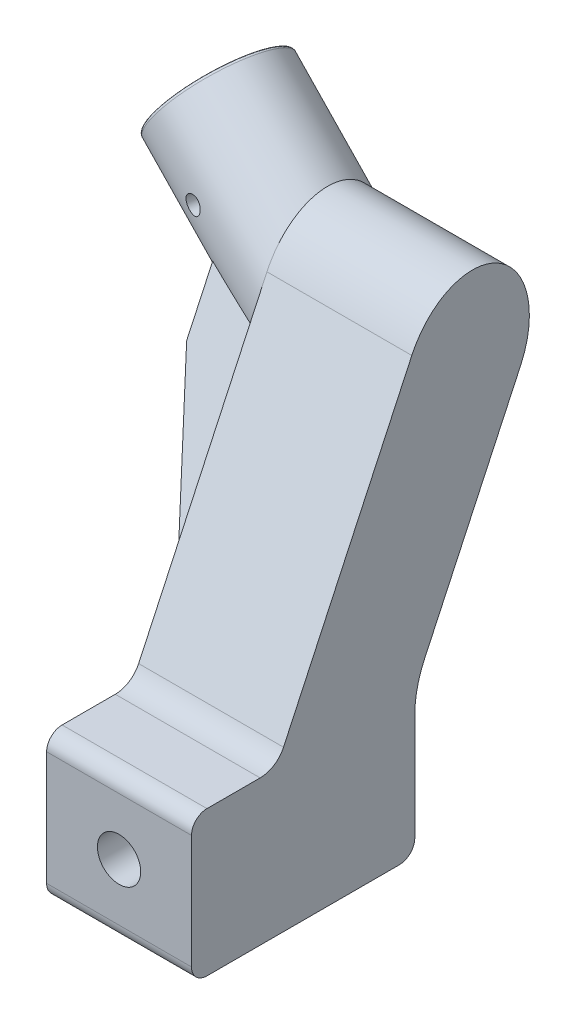
from build123d import *

# Parameters (mm, degrees)
BOSS_EXTRUDE1_REACH      = 70.941
SKETCH2_R                = 12.05
SKETCH2_R_2              = 10.05
CUT_EXTRUDE4_DEPTH       = 45.361925701
CUT_EXTRUDE4_DEPTH_BACK  = 45.361925701
SKETCH15_R               = 1.7
BOSS_EXTRUDE2_DEPTH      = 28.098
CUT_EXTRUDE2_DEPTH       = 95.819673868
CUT_EXTRUDE2_DEPTH_BACK  = 7.874
SKETCH10_R               = 11.074
CUT_EXTRUDE3_DEPTH       = 92.491925461
CUT_EXTRUDE3_DEPTH_BACK  = 92.491925461
SKETCH11_R               = 4.2
FILLET8_R                = 20
FILLET9_R                = 3
FILLET10_R               = 0.5
FILLET11_R               = 5
BOSS_EXTRUDE6_DEPTH      = 9
BOSS_EXTRUDE7_REACH      = 88.141
BOSS_EXTRUDE7_END_RADIUS = 12.05


with BuildPart() as part:
    # Boss-Extrude1: up to this plane
    boss_extrude1_end = Plane(origin=(0, 0, 0), z_dir=(1, 0, 0))
    # Sketch2 → Boss-Extrude1 (new, up to the surface)
    with BuildSketch(Plane(origin=(-24.54792956, 16.693219235, -4.328462302), x_dir=(-0.11959871019830814, -0.41029591122071263, -0.9040759999880907), z_dir=(-0.8182643186533396, 0.556440641176915, -0.1442820767296128)), mode=Mode.PRIVATE) as boss_extrude1_sk1:
        Circle(SKETCH2_R)
        Circle(SKETCH2_R_2, mode=Mode.SUBTRACT)
    boss_extrude1_tool1 = split(extrude(boss_extrude1_sk1.sketch, amount=-BOSS_EXTRUDE1_REACH, mode=Mode.PRIVATE), bisect_by=boss_extrude1_end, keep=Keep.BOTH, mode=Mode.PRIVATE)
    add(boss_extrude1_tool1.solids().sort_by_distance((-23.147527, 21.497446, 6.257521))[0])

    # Sketch15 → Cut-Extrude4 (cut, two sides: drawn at the far end of the back side and taken through both)
    with BuildSketch(Plane(origin=(0, 0, 0), x_dir=(0, -1, 0), z_dir=(0.17364817766693072, 0, -0.984807753012208)).offset(-CUT_EXTRUDE4_DEPTH_BACK)):
        with Locations((-9.05807293, 13.52568053)):
            Circle(SKETCH15_R)
    extrude(amount=CUT_EXTRUDE4_DEPTH + CUT_EXTRUDE4_DEPTH_BACK, mode=Mode.SUBTRACT)

    # Sketch4 → Boss-Extrude2 (add)
    with BuildSketch(Plane(origin=(0, 0, 0), x_dir=(0, 0, -1), z_dir=(1, 0, 0))):
        with BuildLine():
            Line((-10.564289597, 6.088663203), (-36.79343786, -50.159926765))
            Line((-36.79343786, -50.159926765), (-53.29343786, -50.159926765))
            Line((-53.29343786, -50.159926765), (-53.29343786, -78.259926765))
            Line((-53.29343786, -78.259926765), (-9.986478106, -78.259926765))
            Line((-9.986478106, -78.259926765), (-9.986478106, -50.159926765))
            Line((-9.986478106, -50.159926765), (10.564289597, -6.088663203))
            add(Edge.make_bspline(
                [(10.564289597, -6.088663203), (12.310435201, -2.344041872), (13.351511276, 2.865076656), (12.175818184, 8.040449248), (9.161589312, 11.517101667), (5.72338805, 13.498687776), (5.249277659, 13.733812564), (4.752089372, 13.940747349), (4.233531889, 14.115559854), (0.667047101, 15.04033025), (-3.094527455, 14.706908379), (-6.583627983, 12.515676914), (-9.081213608, 9.269129926), (-10.564289597, 6.088663203)],
                knots=[4.490407715, 4.490407715, 4.490407715, 4.490407715, 4.490407715, 4.490407715, 6.061204042, 6.061204042, 6.061204042, 6.061204042, 6.297856005, 6.297856005, 6.297856005, 6.297856005, 7.632000369, 7.632000369, 7.632000369, 7.632000369, 7.632000369, 7.632000369], degree=5, weights=[1, 1, 0.965685425, 0.965685425, 1, 1, 1.000003514, 1.000001188, 1, 1, 0.979939626, 0.982930028, 1, 1]))
        make_face()
    extrude(amount=BOSS_EXTRUDE2_DEPTH)

    # Sketch10 → Cut-Extrude2 (cut, two sides: drawn at the far end of the back side and taken through both)
    with BuildSketch(Plane(origin=(0, 0, 9.986478106), x_dir=(-1, 0, 0), z_dir=(0, 0, -1)).offset(-CUT_EXTRUDE2_DEPTH_BACK)):
        with Locations((-14.049, -64.209926765)):
            Circle(SKETCH10_R)
    extrude(amount=CUT_EXTRUDE2_DEPTH + CUT_EXTRUDE2_DEPTH_BACK, mode=Mode.SUBTRACT)

    # Sketch11 → Cut-Extrude3 (cut, two sides: drawn at the far end of the back side and taken through both)
    with BuildSketch(Plane(origin=(0, 0, 17.860478106), x_dir=(-1, 0, 0), z_dir=(0, 0, -1)).offset(-CUT_EXTRUDE3_DEPTH_BACK)):
        with Locations((-14.049, -64.209926765)):
            Circle(SKETCH11_R)
    extrude(amount=CUT_EXTRUDE3_DEPTH + CUT_EXTRUDE3_DEPTH_BACK, mode=Mode.SUBTRACT)

    # Fillet8
    fillet8_edges = [part.edges().sort_by_distance(p)[0] for p in [
        (14.049, -50.159926765, 9.986478106),
    ]]
    fillet(fillet8_edges, radius=FILLET8_R)

    # Fillet9
    fillet9_edges = [part.edges().sort_by_distance(p)[0] for p in [
        (14.049, -78.259926765, 9.986478106),
        (14.049, -50.159926765, 53.29343786),
        (14.049, -78.259926765, 53.29343786),
    ]]
    fillet(fillet9_edges, radius=FILLET9_R)

    # Fillet10
    fillet10_edges = [part.edges().sort_by_distance(p)[0] for p in [
        (-23.106765102, 21.637284966, 6.565653498),
        (-23.345962522, 20.816693143, 4.757501498),
    ]]
    fillet(fillet10_edges, radius=FILLET10_R)

    # Fillet11
    fillet11_edges = [part.edges().sort_by_distance(p)[0] for p in [
        (14.049, -50.159926765, 36.79343786),
    ]]
    fillet(fillet11_edges, radius=FILLET11_R)

    # Sketch12 → Boss-Extrude6 (add, symmetric)
    with BuildSketch(Plane(origin=(0, 0, 0), x_dir=(1, 0, 0), z_dir=(0, -0.4226182617407002, -0.9063077870366496))):
        Polygon((0, 47.041575241), (0, 14.645822487), (-11.791089719, 14.645822487), align=None)
    extrude(amount=BOSS_EXTRUDE6_DEPTH, both=True)

    # Boss-Extrude7: up to this cylinder (the profile starts outside it)
    boss_extrude7_end = Plane(origin=(2.827034788, -1.922455879, 0.498482509), z_dir=(-0.8182643186533395, 0.556440641176915, -0.1442820767296128)) * Cylinder(BOSS_EXTRUDE7_END_RADIUS, 201.382, mode=Mode.PRIVATE)
    # Sketch13 → Boss-Extrude7 (add, up to the surface)
    with BuildSketch(Plane(origin=(0, -13.273622968, 6.189592041), x_dir=(1, 0, 0), z_dir=(0, 0.9063077870366496, -0.4226182617407002)), mode=Mode.PRIVATE) as boss_extrude7_sk1:
        Polygon((-11.791089719, -9), (0, -9), (0, 0.873838193), (0, 9), (-11.791089719, 9), align=None)
    boss_extrude7_tool1 = extrude(boss_extrude7_sk1.sketch, amount=BOSS_EXTRUDE7_REACH, mode=Mode.PRIVATE) - boss_extrude7_end
    add(boss_extrude7_tool1.solids().sort_by_distance((-5.895545, -13.273623, 6.189592))[0])


solid = part.part
